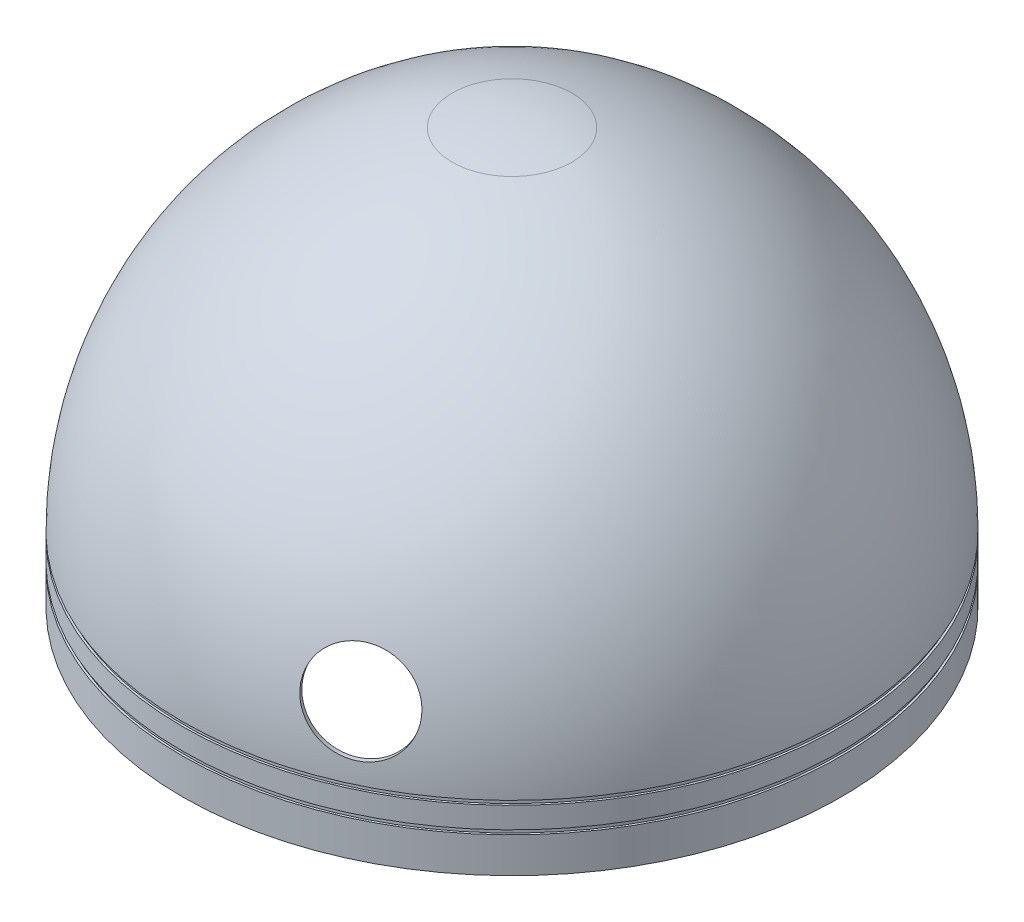
from build123d import *

# Parameters (mm, degrees)
CUT_EXTRUDE_2_OUTLINE_W = 32.25
CUT_EXTRUDE_2_OUTLINE_H = 15.296775487


# Read off the part's stored shape, not the designer's step: Вырез-Вытянуть2
with BuildPart() as part:
    # Эскиз1 → Повернуть1 (revolve)
    with BuildSketch(Plane.XY, mode=Mode.PRIVATE) as revolve_1_sk:
        with BuildLine():
            Line((232.5, 0), (232.5, 25))
            Line((232.5, 25), (231, 25))
            Line((231, 25), (231, 28))
            Line((231, 28), (232.5, 28))
            Line((232.5, 28), (232.5, 43))
            Line((232.5, 43), (231, 43))
            Line((231, 43), (231, 46))
            Line((231, 46), (232.5, 46))
            ThreePointArc((232.5, 46), (179.410823656, 201.746650977), (42.248868308, 292.642624161))
            ThreePointArc((42.248868308, 292.642624161), (21.236487454, 295.907774503), (0, 297))
            Line((0, 297), (0, 294))
            ThreePointArc((0, 294), (20.890545181, 292.927536628), (41.561439926, 289.721422765))
            ThreePointArc((41.561439926, 289.721422765), (176.139339757, 201.069057845), (229.482142224, 49))
            Line((229.482142224, 49), (229.482142224, 0))
            Line((229.482142224, 0), (232.5, 0))
        make_face()
    revolve(revolve_1_sk.sketch.rotate(Axis((0, 0, 0), (0, 1, 0)), 90), axis=Axis((0, 0, 0), (0, 1, 0)))

    # Вырез-Вытянуть2 outline → Вырез-Вытянуть2 (revolve, cut)
    with BuildSketch(Plane(origin=(0, 92.77, 0), x_dir=(0.9025852843498602, 0, -0.4305110968082962), z_dir=(0, -1, 0))):
        with Locations((16.125, 224.438327692)):
            Rectangle(CUT_EXTRUDE_2_OUTLINE_W, CUT_EXTRUDE_2_OUTLINE_H)
    revolve(axis=Axis((0, 92.77, 0), (0.4305110968082962, 0, 0.9025852843498602)), mode=Mode.SUBTRACT)


solid = part.part
